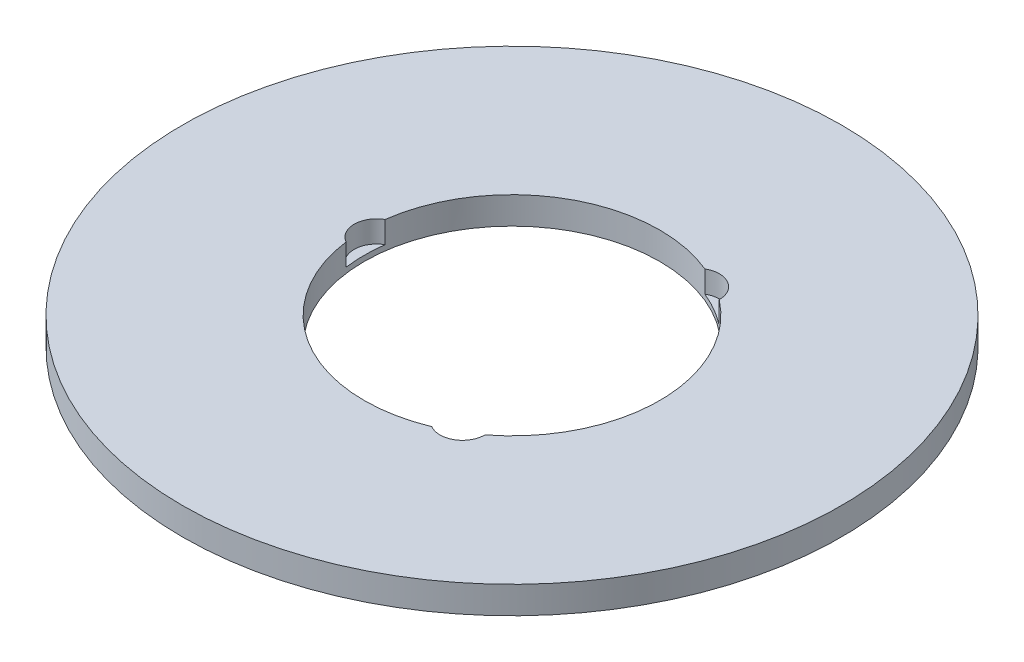
from build123d import *

# Parameters (mm, degrees)
SKETCH1_R           = 72.5
BOSS_EXTRUDE1_DEPTH = 6
SKETCH2_R           = 32.5
CUT_EXTRUDE1_DEPTH  = 103.705890776
SKETCH3_R           = 4.920040128
CUT_EXTRUDE2_DEPTH  = 4.804474114
CIRPATTERN1_COUNT   = 3


with BuildPart() as part:
    # Sketch1 → Boss-Extrude1 (new body)
    with BuildSketch(Plane(origin=(0, 0, 0), x_dir=(1, 0, 0), z_dir=(0, 1, 0))):
        Circle(SKETCH1_R)
    extrude(amount=BOSS_EXTRUDE1_DEPTH)

    # Sketch2 → Cut-Extrude1 (cut, through all)
    with BuildSketch(Plane(origin=(0, 0, 0), x_dir=(1, 0, 0), z_dir=(0, 1, 0))):
        Circle(SKETCH2_R)
    extrude(amount=CUT_EXTRUDE1_DEPTH, mode=Mode.SUBTRACT)

    # Sketch3 → Cut-Extrude2 (cut)
    with BuildSketch(Plane(origin=(0, 6, 0), x_dir=(1, 0, 0), z_dir=(0, 1, 0))):
        with Locations((-29.795239774, 0)):
            Circle(SKETCH3_R)
    cut_extrude2 = extrude(amount=-CUT_EXTRUDE2_DEPTH, mode=Mode.SUBTRACT)

    # CirPattern1: Cut-Extrude2 ×3 about axis
    cirpattern1_axis = Axis((0, 0, 0), (0, 1, 0))
    for i in range(1, CIRPATTERN1_COUNT):
        add(cut_extrude2.rotate(cirpattern1_axis, i * 360 / CIRPATTERN1_COUNT), mode=Mode.SUBTRACT)


solid = part.part
